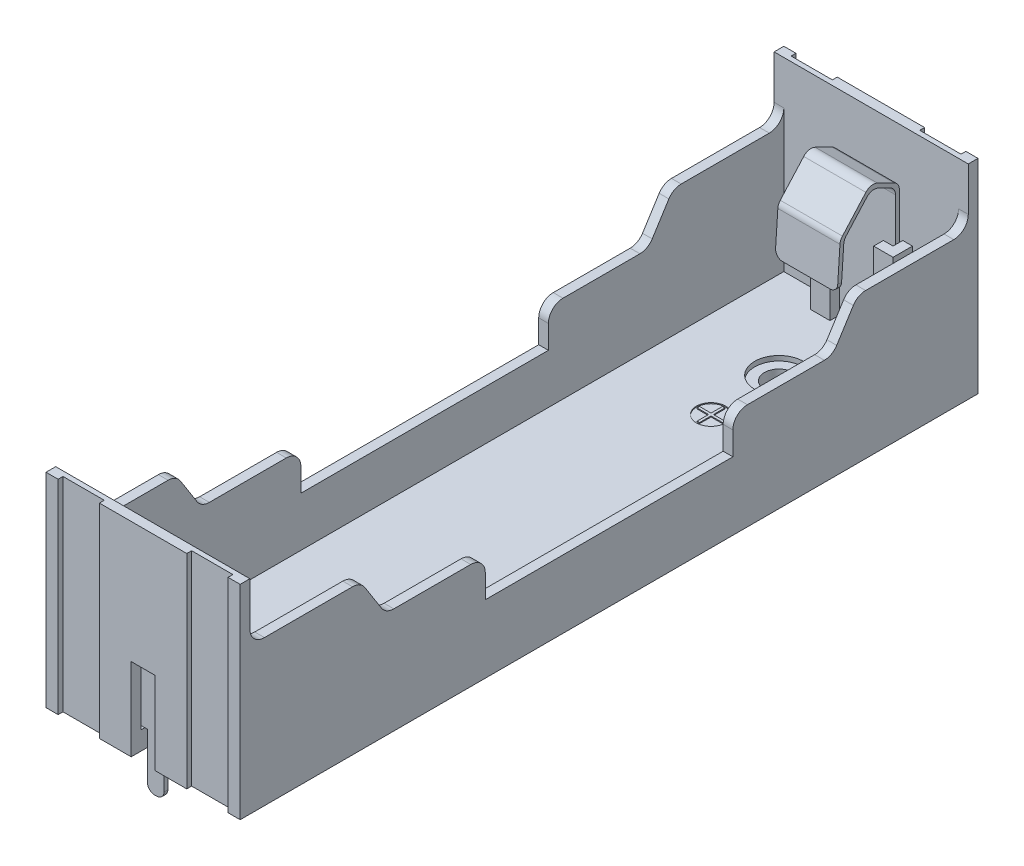
from build123d import *

# Parameters (mm, degrees)
SKETCH_1_W                  = 20
SKETCH_1_H                  = 76
EXTRUDE_778_DEPTH           = 21
CUT_EXTRUDE_1893_DEPTH      = 45.55333882
SKETCH_3_W                  = 18
SKETCH_3_H                  = 74
CUT_EXTRUDE_2454_DEPTH      = 19.1
CUT_EXTRUDE_2746_DEPTH      = 15
CUT_EXTRUDE_2746_DEPTH_BACK = 15
SKETCH_4_W                  = 74
SKETCH_4_H                  = 12
CUT_EXTRUDE_3345_DEPTH      = 15
FILLET_2_R                  = 1.5
FILLET_2_OF_MIRROR_2_R      = 1.5
SKETCH_6_W                  = 2.45
SKETCH_6_H                  = 7
CUT_EXTRUDE_4469_DEPTH      = 8.5
SKETCH_11_R                 = 1.5
CUT_EXTRUDE_4810_DEPTH      = 45.55333882
EXTRUDE_START               = -0.3
SKETCH_12_R                 = 2.8
SKETCH_12_R_2               = 1.5
EXTRUDE_5231_DEPTH          = 0.3
CUT_EXTRUDE_START           = -0.5
SKETCH_13_R                 = 2.5
SKETCH_13_R_2               = 1.5
CUT_EXTRUDE_17_DEPTH        = 0.5
SKETCH_14_R                 = 1.5
SKETCH_14_W                 = 0.25
SKETCH_14_H                 = 2.6
CUT_EXTRUDE_8130_DEPTH      = 0.1
EXTRUDE_9542_DEPTH          = 8.9
EXTRUDE_10389_DEPTH         = 3.2
SKETCH_17_W                 = 1.7
SKETCH_17_H                 = 0.4
EXTRUDE_10841_DEPTH         = 5.5
FILLET_3_R                  = 1
FILLET_4_R                  = 0.75


with BuildPart() as part:
    # Эскиз1 → Extrude 778 (new body)
    with BuildSketch(Plane(origin=(0, 0, 0), x_dir=(1, 0, 0), z_dir=(0, 1, 0))):
        Rectangle(SKETCH_1_W, SKETCH_1_H)
    extrude(amount=EXTRUDE_778_DEPTH)

    # Эскиз2 → Cut-Extrude 1893 (cut, through all)
    with BuildSketch(Plane(origin=(0, 0, 0), x_dir=(1, 0, 0), z_dir=(0, 1, 0))):
        Polygon((-4.5, 37.5), (-4.5, 38), (4.5, 38), (4.5, 37.5), (8.75, 37.5), (8.75, 38), (10, 38), (10, 46.507054696), (-10, 46.507054696), (-10, 38), (-8.75, 38), (-8.75, 37.5), align=None)
    cut_extrude_1893 = extrude(amount=CUT_EXTRUDE_1893_DEPTH, mode=Mode.SUBTRACT)

    # Зеркальное отражение1: Cut-Extrude 1893 across plane
    add(cut_extrude_1893.mirror(Plane.XY), mode=Mode.SUBTRACT)

    # Эскиз3 → Cut-Extrude 2454 (cut)
    with BuildSketch(Plane(origin=(0, 21, 0), x_dir=(1, 0, 0), z_dir=(0, 1, 0))):
        Rectangle(SKETCH_3_W, SKETCH_3_H)
    extrude(amount=-CUT_EXTRUDE_2454_DEPTH, mode=Mode.SUBTRACT)

    # Эскиз4 → Cut-Extrude 2746 (cut, two sides: drawn at the far end of the back side and taken through both)
    with BuildSketch(Plane(origin=(0, 0, 0), x_dir=(0, 0, -1), z_dir=(1, 0, 0)).offset(-CUT_EXTRUDE_2746_DEPTH_BACK)):
        with Locations((0, 21)):
            Rectangle(SKETCH_4_W, SKETCH_4_H)
    extrude(amount=CUT_EXTRUDE_2746_DEPTH + CUT_EXTRUDE_2746_DEPTH_BACK, mode=Mode.SUBTRACT)

    # Эскиз5 → Cut-Extrude 3345 (cut)
    with BuildSketch(Plane(origin=(10, 0, 0), x_dir=(0, 0, -1), z_dir=(1, 0, 0))):
        Polygon((35.6, 21), (-35.6, 21), (-35.6, 15), (-25.6, 15), (-23, 10.9), (-12.75, 10.9), (-12.75, 7), (12.75, 7), (12.75, 10.9), (23, 10.9), (25.6, 15), (35.6, 15), align=None)
    cut_extrude_3345 = extrude(amount=-CUT_EXTRUDE_3345_DEPTH, mode=Mode.SUBTRACT)

    # Скругление2
    fillet_2_edges = [part.edges().sort_by_distance(p)[0] for p in [
        (9.5, 10.9, -23),
        (9.5, 10.9, -12.75),
        (9.5, 10.9, 12.75),
        (9.5, 10.9, 23),
        (9.5, 15, -37),
        (9.5, 15, -25.6),
        (9.5, 15, 37),
        (9.5, 15, 25.6),
    ]]
    fillet(fillet_2_edges, radius=FILLET_2_R)

    # Зеркальное отражение2: Cut-Extrude 3345 across plane
    add(cut_extrude_3345.mirror(Plane(origin=(0, 0, 0), x_dir=(0, 0, 1), z_dir=(1, 0, 0))), mode=Mode.SUBTRACT)

    # Скругление2 of Зеркальное отражение2
    fillet_2_of_mirror_2_edges = [part.edges().sort_by_distance(p)[0] for p in [
        (-9.5, 10.9, -23),
        (-9.5, 10.9, -12.75),
        (-9.5, 10.9, 12.75),
        (-9.5, 10.9, 23),
        (-9.5, 15, -37),
        (-9.5, 15, -25.6),
        (-9.5, 15, 37),
        (-9.5, 15, 25.6),
    ]]
    fillet(fillet_2_of_mirror_2_edges, radius=FILLET_2_OF_MIRROR_2_R)

    # Эскиз6 → Cut-Extrude 4469 (cut)
    with BuildSketch(Plane(origin=(0, 0, 0), x_dir=(1, 0, 0), z_dir=(0, 1, 0))):
        with Locations((0, -38)):
            Rectangle(SKETCH_6_W, SKETCH_6_H)
        with Locations((0, 38)):
            Rectangle(SKETCH_6_W, SKETCH_6_H)
    extrude(amount=CUT_EXTRUDE_4469_DEPTH, mode=Mode.SUBTRACT)

    # Эскиз11 → Cut-Extrude 4810 (cut, through all)
    with BuildSketch(Plane(origin=(0, 0, 0), x_dir=(1, 0, 0), z_dir=(0, 1, 0))):
        with Locations((0, 27.5)):
            Circle(SKETCH_11_R)
        with Locations((0, -27.5)):
            Circle(SKETCH_11_R)
    extrude(amount=CUT_EXTRUDE_4810_DEPTH, mode=Mode.SUBTRACT)

    # Эскиз12 → Extrude 5231 (add)
    # profile 1 of 2: a face of its own
    with BuildSketch(Plane(origin=(0, 0, 0), x_dir=(1, 0, 0), z_dir=(0, 1, 0)).offset(EXTRUDE_START)):
        with Locations((0, 27.5)):
            Circle(SKETCH_12_R)
        with Locations((0, 27.5)):
            Circle(SKETCH_12_R_2, mode=Mode.SUBTRACT)
    # profile 2 of 2: a face of its own
    with BuildSketch(Plane(origin=(0, 0, 0), x_dir=(1, 0, 0), z_dir=(0, 1, 0)).offset(EXTRUDE_START)):
        with Locations((0, -27.5)):
            Circle(SKETCH_12_R)
        with Locations((0, -27.5)):
            Circle(SKETCH_12_R_2, mode=Mode.SUBTRACT)
    extrude(amount=EXTRUDE_5231_DEPTH)

    # Эскиз13 → Вырез-Вытянуть17 (cut)
    # profile 1 of 2: a face of its own
    with BuildSketch(Plane(origin=(0, 1.9, 0), x_dir=(1, 0, 0), z_dir=(0, 1, 0)).offset(CUT_EXTRUDE_START)):
        with Locations((0, -27.5)):
            Circle(SKETCH_13_R)
        with Locations((0, -27.5)):
            Circle(SKETCH_13_R_2, mode=Mode.SUBTRACT)
    # profile 2 of 2: a face of its own
    with BuildSketch(Plane(origin=(0, 1.9, 0), x_dir=(1, 0, 0), z_dir=(0, 1, 0)).offset(CUT_EXTRUDE_START)):
        with Locations((0, 27.5)):
            Circle(SKETCH_13_R)
        with Locations((0, 27.5)):
            Circle(SKETCH_13_R_2, mode=Mode.SUBTRACT)
    extrude(amount=CUT_EXTRUDE_17_DEPTH, mode=Mode.SUBTRACT)

    # Эскиз14 → Cut-Extrude 8130 (cut)
    # profile 1 of 2: a face of its own
    with BuildSketch(Plane(origin=(0, 1.9, 0), x_dir=(1, 0, 0), z_dir=(0, 1, 0))):
        with Locations((0, 20.5)):
            Circle(SKETCH_14_R)
        Polygon((-0.125, 21.8), (0.125, 21.8), (0.125, 20.625), (1.3, 20.625), (1.3, 20.375), (0.125, 20.375), (0.125, 19.2), (-0.125, 19.2), (-0.125, 20.375), (-1.3, 20.375), (-1.3, 20.625), (-0.125, 20.625), align=None, mode=Mode.SUBTRACT)
    # profile 2 of 2: a face of its own
    with BuildSketch(Plane(origin=(0, 1.9, 0), x_dir=(1, 0, 0), z_dir=(0, 1, 0))):
        with Locations((0, -20.5)):
            Circle(SKETCH_14_R)
        with Locations((0, -20.5)):
            Rectangle(SKETCH_14_W, SKETCH_14_H, mode=Mode.SUBTRACT)
    extrude(amount=-CUT_EXTRUDE_8130_DEPTH, mode=Mode.SUBTRACT)

    # Эскиз15 → Extrude 9542 (add)
    with BuildSketch(Plane(origin=(0, 1.9, 0), x_dir=(1, 0, 0), z_dir=(0, 1, 0))):
        Polygon((-2.25, 35), (-4.25, 35), (-4.25, 37), (-3.25, 37), (-3.25, 36), (-2.25, 36), align=None)
        Polygon((2.25, 35), (2.25, 36), (3.25, 36), (3.25, 37), (4.25, 37), (4.25, 35), align=None)
        Polygon((4.25, -35), (2.25, -35), (2.25, -36), (3.25, -36), (3.25, -37), (4.25, -37), align=None)
        Polygon((-2.25, -36), (-2.25, -35), (-4.25, -35), (-4.25, -37), (-3.25, -37), (-3.25, -36), align=None)
    extrude(amount=EXTRUDE_9542_DEPTH)


with BuildPart() as body_2:
    # Эскиз16 → Extrude 10389 (new, symmetric)
    with BuildSketch(Plane.ZY):
        Polygon((-36.3, 2), (-36.3, 15.826972516), (-33.848539634, 17.01426896), (-30.994965619, 13.823876222), (-30.699555061, 9.402575836), (-30.300444939, 9.429242503), (-30.605034381, 13.987919845), (-33.751460366, 17.50573104), (-36.7, 16.077688118), (-36.7, 2), align=None)
    extrude(amount=EXTRUDE_10389_DEPTH, both=True)

    # Эскиз17 → Extrude 10841 (add)
    with BuildSketch(Plane.XZ.offset(-2)):
        with Locations((0, -36.5)):
            Rectangle(SKETCH_17_W, SKETCH_17_H)
    extrude(amount=EXTRUDE_10841_DEPTH)

    # Скругление3
    fillet_3_edges = [body_2.edges().sort_by_distance(p)[0] for p in [
        (0, 13.823876222, -30.994965619),
        (0, 13.987919845, -30.605034381),
        (0, 17.01426896, -33.848539634),
        (0, 17.50573104, -33.751460366),
        (0, 15.826972516, -36.3),
        (0, 16.077688118, -36.7),
    ]]
    fillet(fillet_3_edges, radius=FILLET_3_R)

    # Скругление4
    fillet_4_edges = [body_2.edges().sort_by_distance(p)[0] for p in [
        (3.2, 2, -36.5),
        (0.85, -3.5, -36.5),
        (-0.85, -3.5, -36.5),
        (-3.2, 2, -36.5),
        (3.2, 9.41590917, -30.5),
        (-3.2, 9.41590917, -30.5),
    ]]
    fillet(fillet_4_edges, radius=FILLET_4_R)


with BuildPart() as body_3:
    # Mirror1: mirrored copy
    add(body_2.part.mirror(Plane.XY))


solid = Compound([part.part, body_2.part, body_3.part])
